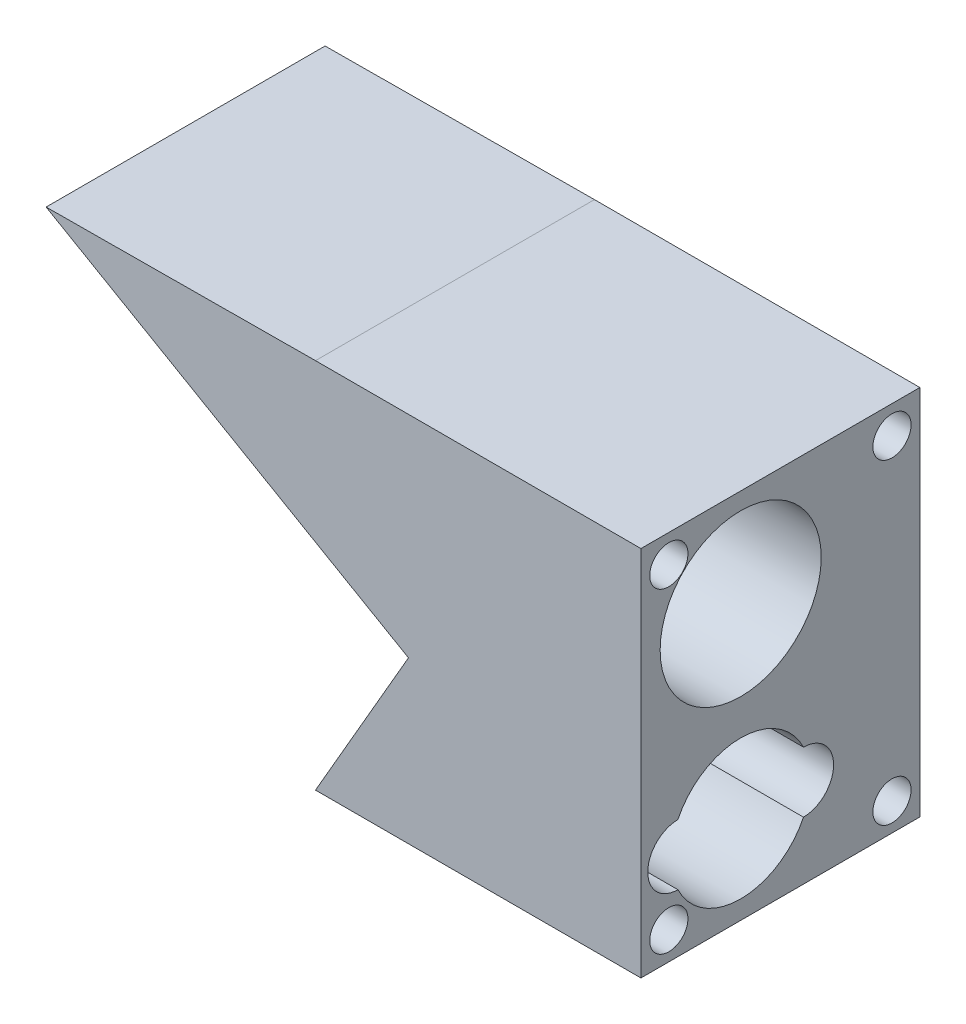
from build123d import *

# Parameters (mm, degrees)
SKETCH2_W                       = 44.45
SKETCH2_H                       = 50.8
BOSS_EXTRUDE2_DEPTH             = 38.1
F_5_0_2055_DIAMETER_HOLE1_D     = 5.2197
F_5_0_2055_DIAMETER_HOLE1_DEPTH = 12.7
F_5_0_2055_DIAMETER_HOLE1_TIP   = 1.568156087
BOSS_EXTRUDE3_DEPTH             = 38.1
CUT_EXTRUDE2_DEPTH              = 91.130758783
CUT_EXTRUDE1_DEPTH              = 94.523620717
CUT_EXTRUDE1_DEPTH_BACK         = 94.523620717
SKETCH3_R                       = 11


with BuildPart() as part:
    # Sketch2 → Boss-Extrude2 (new body)
    with BuildSketch(Plane.XY):
        with Locations((-18.295089844, 0.954798727)):
            Rectangle(SKETCH2_W, SKETCH2_H)
    extrude(amount=BOSS_EXTRUDE2_DEPTH)

    # #5 (0.2055) Diameter Hole1
    with Locations(Plane(origin=(3.929910156, 22.544798727, 34.29), x_dir=(0, 1, 0), z_dir=(1, 0, 0))):
        with Locations((0, 0), (0, -30.48), (-43.18, -30.48), (-43.18, 0)):
            Hole(F_5_0_2055_DIAMETER_HOLE1_D / 2, depth=F_5_0_2055_DIAMETER_HOLE1_DEPTH)
            with Locations((0, 0, -(F_5_0_2055_DIAMETER_HOLE1_DEPTH + F_5_0_2055_DIAMETER_HOLE1_TIP / 2))):  # 118° drill point
                Cone(0, F_5_0_2055_DIAMETER_HOLE1_D / 2, F_5_0_2055_DIAMETER_HOLE1_TIP, mode=Mode.SUBTRACT)

    # Sketch6 → Boss-Extrude3 (add)
    with BuildSketch(Plane(origin=(0, 0, 0), x_dir=(-1, 0, 0), z_dir=(0, 0, -1))):
        Polygon((40.520089844, 26.354798727), (77.31344167, 26.126843983), (40.520089844, 4.884192402), align=None)
    extrude(amount=-BOSS_EXTRUDE3_DEPTH)

    # Sketch7 → Cut-Extrude2 (cut, through all)
    with BuildSketch(Plane(origin=(0, 0, 0), x_dir=(-1, 0, 0), z_dir=(0, 0, -1))):
        Polygon((40.520089844, 4.884192402), (27.820089844, -2.448156017), (40.520089844, -24.445201273), align=None)
    extrude(amount=-CUT_EXTRUDE2_DEPTH, mode=Mode.SUBTRACT)

    # Sketch3 → Cut-Extrude1 (cut, two sides: drawn at the far end of the back side and taken through both)
    with BuildSketch(Plane(origin=(3.929910156, 0, 0), x_dir=(0, 0, -1), z_dir=(1, 0, 0)).offset(-CUT_EXTRUDE1_DEPTH_BACK)):
        with Locations((-24.476370381, 13.019798727)):
            Circle(SKETCH3_R)
        with BuildLine():
            ThreePointArc((-33.05370099, -16.52206373), (-24.476370381, -21.905201273), (-15.899039771, -16.52206373))
            ThreePointArc((-15.899039771, -16.52206373), (-11.784069767, -12.380201273), (-15.899039771, -8.238338816))
            ThreePointArc((-15.899039771, -8.238338816), (-24.476370381, -2.855201273), (-33.05370099, -8.238338816))
            ThreePointArc((-33.05370099, -8.238338816), (-37.168670994, -12.380201273), (-33.05370099, -16.52206373))
        make_face()
    extrude(amount=CUT_EXTRUDE1_DEPTH + CUT_EXTRUDE1_DEPTH_BACK, mode=Mode.SUBTRACT)


solid = part.part
